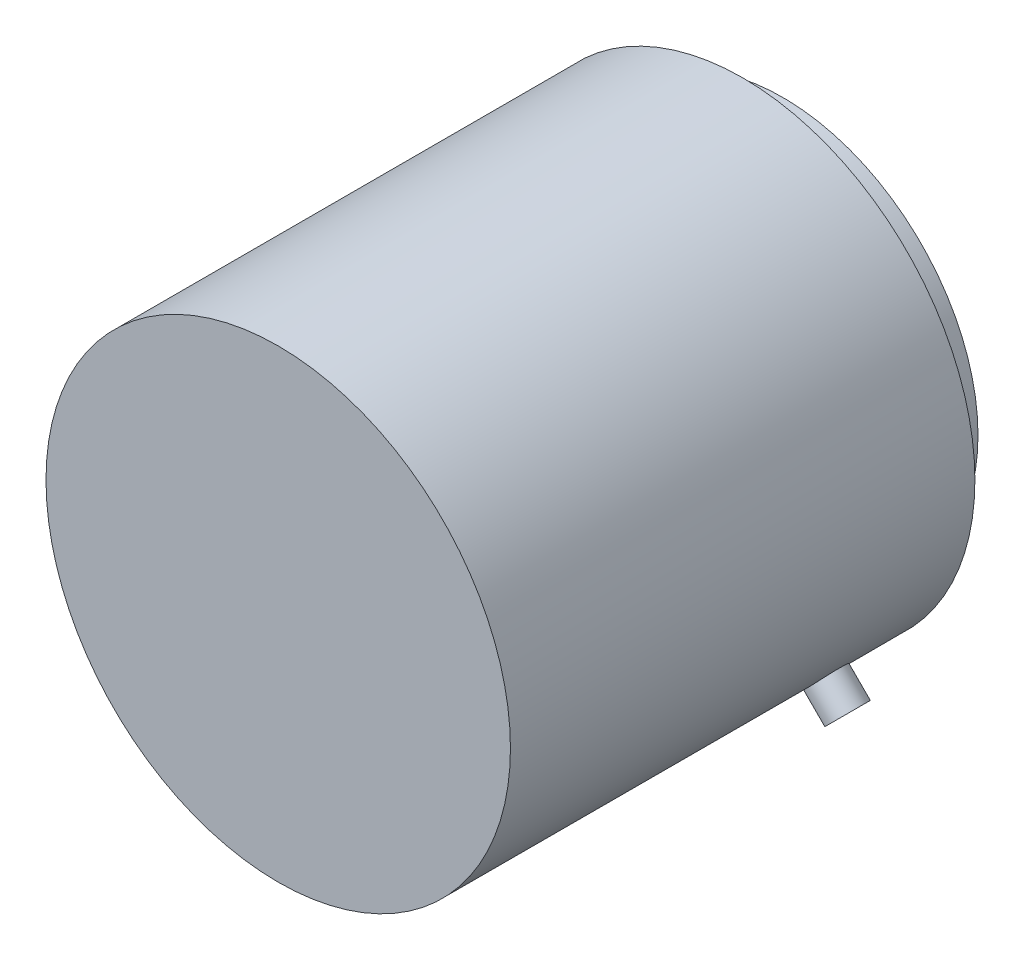
from build123d import *

# Parameters (mm, degrees)
SKETCH1_R               = 37.5
BOSS_EXTRUDE1_DEPTH     = 75
SKETCH2_R               = 31.5
BOSS_EXTRUDE2_DEPTH     = 6.5
SKETCH3_R               = 15.75
CUT_EXTRUDE1_DEPTH      = 6.5
SKETCH4_R               = 3
CUT_EXTRUDE2_DEPTH      = 5
BOSS_EXTRUDE3_START     = -10
BOSS_EXTRUDE3_DEPTH     = 6
CUT_EXTRUDE4_REACH      = 123.333
CUT_EXTRUDE4_END_RADIUS = 37.5
SKETCH7_R               = 7.955992876
SKETCH7_R_2             = 3


with BuildPart() as part:
    # Sketch1 → Boss-Extrude1 (new body)
    with BuildSketch(Plane.XY):
        Circle(SKETCH1_R)
    extrude(amount=BOSS_EXTRUDE1_DEPTH)

    # Sketch2 → Boss-Extrude2 (add)
    with BuildSketch(Plane(origin=(0, 0, 0), x_dir=(-1, 0, 0), z_dir=(0, 0, -1))):
        Circle(SKETCH2_R)
    extrude(amount=BOSS_EXTRUDE2_DEPTH)

    # Sketch3 → Cut-Extrude1 (cut)
    with BuildSketch(Plane(origin=(0, 0, -6.5), x_dir=(-1, 0, 0), z_dir=(0, 0, -1))):
        Circle(SKETCH3_R)
    extrude(amount=-CUT_EXTRUDE1_DEPTH, mode=Mode.SUBTRACT)

    # Sketch4 → Cut-Extrude2 (cut)
    with BuildSketch(Plane(origin=(0, 0, -6.5), x_dir=(-1, 0, 0), z_dir=(0, 0, -1))):
        with Locations((25, 0)):
            Circle(SKETCH4_R)
        with Locations((0, 25)):
            Circle(SKETCH4_R)
        with Locations((0, -25)):
            Circle(SKETCH4_R)
        with Locations((-25, 0)):
            Circle(SKETCH4_R)
    extrude(amount=-CUT_EXTRUDE2_DEPTH, mode=Mode.SUBTRACT)

    # Sketch6 → Boss-Extrude3 (add)
    with BuildSketch(Plane(origin=(0, 0, 0), x_dir=(-1, 0, 0), z_dir=(0, 0, -1)).offset(BOSS_EXTRUDE3_START)):
        with BuildLine():
            ThreePointArc((-24.310194937, -28.552835624), (-26.516504294, -26.516504294), (-28.552835624, -24.310194937))
            Line((-28.552835624, -24.310194936), (-32.062724579, -27.820083892))
            Line((-32.062724579, -27.820083892), (-27.820083892, -32.062724579))
            Line((-27.820083892, -32.062724579), (-24.310194936, -28.552835624))
        make_face()
    extrude(amount=-BOSS_EXTRUDE3_DEPTH)

    # Cut-Extrude4: up to this cylinder (the profile starts outside it)
    cut_extrude4_end = Plane(origin=(0, 0, 20.730963), z_dir=(0, 0, -1)) * Cylinder(CUT_EXTRUDE4_END_RADIUS, 322.666, mode=Mode.PRIVATE)
    # Sketch7 → Cut-Extrude4 (cut, up to the surface)
    with BuildSketch(Plane(origin=(29.941404236, -29.941404236, 0), x_dir=(0, 0, -1), z_dir=(0.7071067811865471, -0.7071067811865479, 0)), mode=Mode.PRIVATE) as cut_extrude4_sk1:
        with Locations((-13, 0)):
            Circle(SKETCH7_R)
        with Locations((-13, 0)):
            Circle(SKETCH7_R_2, mode=Mode.SUBTRACT)
    cut_extrude4_tool1 = extrude(cut_extrude4_sk1.sketch, amount=-CUT_EXTRUDE4_REACH, mode=Mode.PRIVATE) - cut_extrude4_end
    add(cut_extrude4_tool1.solids().sort_by_distance((29.941404, -29.941404, 20.730963))[0], mode=Mode.SUBTRACT)


solid = part.part
